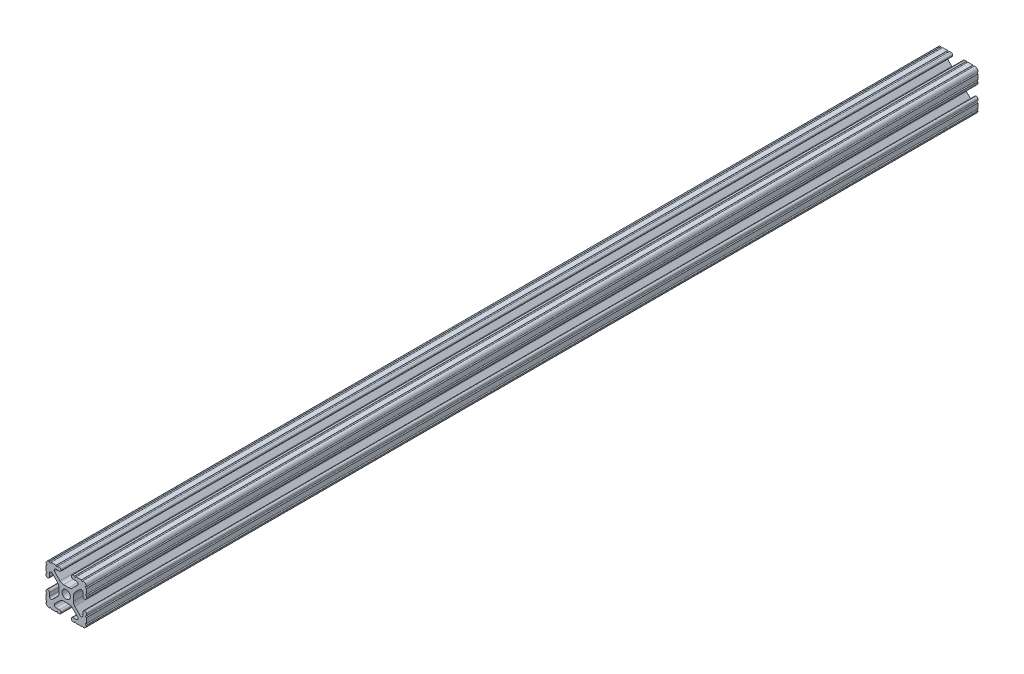
from build123d import *

# Parameters (mm, degrees)
SKETCH1_R           = 2.6035
BOSS_EXTRUDE1_DEPTH = 304.8
SKETCH2_W           = 33.638821573
SKETCH2_H           = 37.212624088
CUT_EXTRUDE1_DEPTH  = 48.26


with BuildPart() as part:
    # Sketch1 → Boss-Extrude1 (new, symmetric)
    with BuildSketch(Plane.XY):
        with BuildLine():
            Line((-7.179650497, -8.645192506), (-3.952270251, -5.423690499))
            ThreePointArc((-3.952270251, -5.423690499), (-2.922936451, -4.736929036), (-1.709253557, -4.4958))
            Line((-1.709253557, -4.4958), (1.709253557, -4.4958))
            ThreePointArc((1.709253557, -4.4958), (2.922936451, -4.736929036), (3.952270251, -5.423690499))
            Line((3.952270251, -5.423690499), (7.179650497, -8.645192506))
            ThreePointArc((7.179650497, -8.645192506), (7.41473083, -9.822813117), (6.416408329, -10.4902))
            Line((6.416408329, -10.4902), (4.287512407, -10.4902))
            ThreePointArc((4.287512407, -10.4902), (3.54574862, -10.79744862), (3.2385, -11.539212407))
            Line((3.2385, -11.539212407), (3.2385, -11.650987593))
            ThreePointArc((3.2385, -11.650987593), (3.54574862, -12.39275138), (4.287512407, -12.7))
            Line((4.287512407, -12.7), (5.317126718, -12.7))
            ThreePointArc((5.317126718, -12.7), (5.825126718, -12.192), (6.333126718, -12.7))
            Line((6.333126718, -12.7), (9.550443118, -12.7))
            ThreePointArc((9.550443118, -12.7), (10.058366869, -12.192000006), (10.566443095, -12.699847501))
            ThreePointArc((10.566443095, -12.699847501), (12.082537762, -12.08250727), (12.699846982, -10.566399977))
            ThreePointArc((12.699846982, -10.566399977), (12.192000006, -10.058323491), (12.7, -9.5504))
            Line((12.7, -9.5504), (12.7, -6.3330836))
            ThreePointArc((12.7, -6.3330836), (12.192, -5.8250836), (12.7, -5.3170836))
            Line((12.7, -5.3170836), (12.7, -4.287469289))
            ThreePointArc((12.7, -4.287469289), (12.39275138, -3.545705502), (11.650987593, -3.238456882))
            Line((11.650987593, -3.238456882), (11.539212407, -3.238456882))
            ThreePointArc((11.539212407, -3.238456882), (10.79744862, -3.545705502), (10.4902, -4.287469289))
            Line((10.4902, -4.287469289), (10.4902, -6.402089023))
            ThreePointArc((10.4902, -6.402089023), (9.856505071, -7.351067942), (8.737131347, -7.129408934))
            Line((8.737131347, -7.129408934), (5.441005833, -3.840816462))
            ThreePointArc((5.441005833, -3.840816462), (4.750877967, -2.809883091), (4.5085, -1.593185507))
            Line((4.5085, -1.593185507), (4.5085, 1.593185507))
            ThreePointArc((4.5085, 1.593185507), (4.750877967, 2.809883091), (5.441005833, 3.840816462))
            Line((5.441005833, 3.840816462), (8.737131347, 7.129408934))
            ThreePointArc((8.737131347, 7.129408934), (9.856505071, 7.351067942), (10.4902, 6.402089023))
            Line((10.4902, 6.402089023), (10.4902, 4.287469289))
            ThreePointArc((10.4902, 4.287469289), (10.79744862, 3.545705502), (11.539212407, 3.238456882))
            Line((11.539212407, 3.238456882), (11.650987593, 3.238456882))
            ThreePointArc((11.650987593, 3.238456882), (12.39275138, 3.545705502), (12.7, 4.287469289))
            Line((12.7, 4.287469289), (12.7, 5.3170836))
            ThreePointArc((12.7, 5.3170836), (12.192, 5.8250836), (12.7, 6.3330836))
            Line((12.7, 6.3330836), (12.7, 9.5504))
            ThreePointArc((12.7, 9.5504), (12.192000006, 10.058323491), (12.699846982, 10.566399977))
            ThreePointArc((12.699846982, 10.566399977), (12.082537762, 12.08250727), (10.566443095, 12.699847501))
            ThreePointArc((10.566443095, 12.699847501), (10.058366869, 12.192000006), (9.550443118, 12.7))
            Line((9.550443118, 12.7), (6.333126718, 12.7))
            ThreePointArc((6.333126718, 12.7), (5.825126718, 12.192), (5.317126718, 12.7))
            Line((5.317126718, 12.7), (4.287512407, 12.7))
            ThreePointArc((4.287512407, 12.7), (3.54574862, 12.39275138), (3.2385, 11.650987593))
            Line((3.2385, 11.650987593), (3.2385, 11.539212407))
            ThreePointArc((3.2385, 11.539212407), (3.54574862, 10.79744862), (4.287512407, 10.4902))
            Line((4.287512407, 10.4902), (6.476788598, 10.4902))
            ThreePointArc((6.476788598, 10.4902), (7.432222385, 9.85140422), (7.207036008, 8.724370562))
            Line((7.207036008, 8.724370562), (3.898272566, 5.423169045))
            ThreePointArc((3.898272566, 5.423169045), (2.869120213, 4.736787962), (1.655778399, 4.4958))
            Line((1.655778399, 4.4958), (-1.655778399, 4.4958))
            ThreePointArc((-1.655778399, 4.4958), (-2.869120213, 4.736787962), (-3.898272566, 5.423169045))
            Line((-3.898272566, 5.423169045), (-7.207036008, 8.724370562))
            ThreePointArc((-7.207036008, 8.724370562), (-7.432222385, 9.85140422), (-6.476788598, 10.4902))
            Line((-6.476788598, 10.4902), (-4.287512407, 10.4902))
            ThreePointArc((-4.287512407, 10.4902), (-3.54574862, 10.79744862), (-3.2385, 11.539212407))
            Line((-3.2385, 11.539212407), (-3.2385, 11.650987593))
            ThreePointArc((-3.2385, 11.650987593), (-3.54574862, 12.39275138), (-4.287512407, 12.7))
            Line((-4.287512407, 12.7), (-5.317126718, 12.7))
            ThreePointArc((-5.317126718, 12.7), (-5.825126718, 12.192), (-6.333126718, 12.7))
            Line((-6.333126718, 12.7), (-9.550443118, 12.7))
            ThreePointArc((-9.550443118, 12.7), (-10.058366869, 12.192000006), (-10.566443095, 12.699847501))
            ThreePointArc((-10.566443095, 12.699847501), (-12.082537762, 12.08250727), (-12.699846982, 10.566399977))
            ThreePointArc((-12.699846982, 10.566399977), (-12.192000006, 10.058323491), (-12.7, 9.5504))
            Line((-12.7, 9.5504), (-12.7, 6.3330836))
            ThreePointArc((-12.7, 6.3330836), (-12.192, 5.8250836), (-12.7, 5.3170836))
            Line((-12.7, 5.3170836), (-12.7, 4.287469289))
            ThreePointArc((-12.7, 4.287469289), (-12.39275138, 3.545705502), (-11.650987593, 3.238456882))
            Line((-11.650987593, 3.238456882), (-11.539212407, 3.238456882))
            ThreePointArc((-11.539212407, 3.238456882), (-10.79744862, 3.545705502), (-10.4902, 4.287469289))
            Line((-10.4902, 4.287469289), (-10.4902, 6.402089023))
            ThreePointArc((-10.4902, 6.402089023), (-9.856505071, 7.351067942), (-8.737131347, 7.129408934))
            Line((-8.737131347, 7.129408934), (-5.441005833, 3.840816462))
            ThreePointArc((-5.441005833, 3.840816462), (-4.750877967, 2.809883091), (-4.5085, 1.593185507))
            Line((-4.5085, 1.593185507), (-4.5085, -1.593185507))
            ThreePointArc((-4.5085, -1.593185507), (-4.750877967, -2.809883091), (-5.441005833, -3.840816462))
            Line((-5.441005833, -3.840816462), (-8.737131347, -7.129408934))
            ThreePointArc((-8.737131347, -7.129408934), (-9.856505071, -7.351067942), (-10.4902, -6.402089023))
            Line((-10.4902, -6.402089023), (-10.4902, -4.287469289))
            ThreePointArc((-10.4902, -4.287469289), (-10.79744862, -3.545705502), (-11.539212407, -3.238456882))
            Line((-11.539212407, -3.238456882), (-11.650987593, -3.238456882))
            ThreePointArc((-11.650987593, -3.238456882), (-12.39275138, -3.545705502), (-12.7, -4.287469289))
            Line((-12.7, -4.287469289), (-12.7, -5.3170836))
            ThreePointArc((-12.7, -5.3170836), (-12.192, -5.8250836), (-12.7, -6.3330836))
            Line((-12.7, -6.3330836), (-12.7, -9.5504))
            ThreePointArc((-12.7, -9.5504), (-12.192000006, -10.058323491), (-12.699846982, -10.566399977))
            ThreePointArc((-12.699846982, -10.566399977), (-12.082537762, -12.08250727), (-10.566443095, -12.699847501))
            ThreePointArc((-10.566443095, -12.699847501), (-10.058366869, -12.192000006), (-9.550443118, -12.7))
            Line((-9.550443118, -12.7), (-6.333126718, -12.7))
            ThreePointArc((-6.333126718, -12.7), (-5.825126718, -12.192), (-5.317126718, -12.7))
            Line((-5.317126718, -12.7), (-4.287512407, -12.7))
            ThreePointArc((-4.287512407, -12.7), (-3.54574862, -12.39275138), (-3.2385, -11.650987593))
            Line((-3.2385, -11.650987593), (-3.2385, -11.539212407))
            ThreePointArc((-3.2385, -11.539212407), (-3.54574862, -10.79744862), (-4.287512407, -10.4902))
            Line((-4.287512407, -10.4902), (-6.416408329, -10.4902))
            ThreePointArc((-6.416408329, -10.4902), (-7.41473083, -9.822813117), (-7.179650497, -8.645192506))
        make_face()
        Circle(SKETCH1_R, mode=Mode.SUBTRACT)
    extrude(amount=BOSS_EXTRUDE1_DEPTH, both=True)

    # Sketch2 → Cut-Extrude1 (cut)
    with BuildSketch(Plane.XY.offset(304.8)):
        with Locations((1.09831089, -1.115775642)):
            Rectangle(SKETCH2_W, SKETCH2_H)
    extrude(amount=-CUT_EXTRUDE1_DEPTH, mode=Mode.SUBTRACT)


solid = part.part
